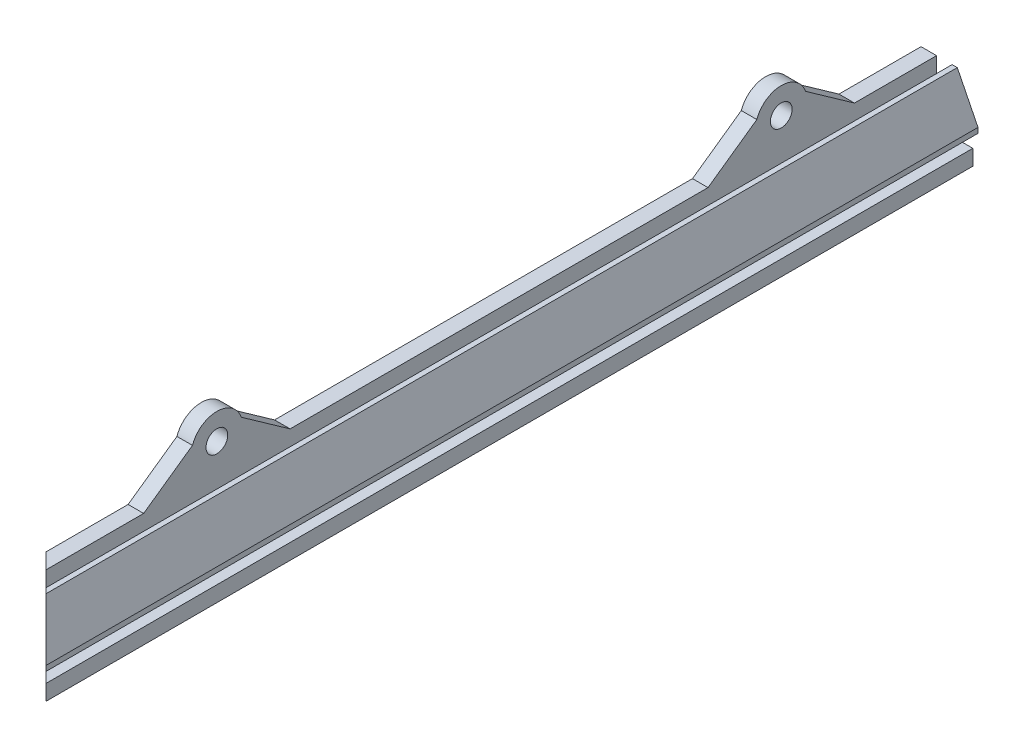
from build123d import *

# Parameters (mm, degrees)
DODANIE_WYCI_GNI_CIE1_DEPTH = 180
WYTNIJ_WYCI_GNI_CIE1_DEPTH  = 181.958558792
SZKIC3_R                    = 2.1
DODANIE_WYCI_GNI_CIE2_DEPTH = 3
SFAZOWANIE1_DEPTH           = 3


with BuildPart() as part:
    # Szkic1 → Dodanie-wyciągnięcie1 (new body)
    with BuildSketch(Plane.XY):
        Polygon((0, 0), (10, 0), (10, 3), (3, 3), (3, 6), (11, 6), (11, 7), (7, 15), (6, 15), (6, 9), (3, 9), (3, 15), (0, 15), align=None)
    extrude(amount=DODANIE_WYCI_GNI_CIE1_DEPTH)

    # Szkic2 → Wytnij-wyciągnięcie1 (cut, through all)
    with BuildSketch(Plane(origin=(0, 15, 0), x_dir=(1, 0, 0), z_dir=(0, 1, 0))):
        Polygon((0, -180), (11, -180), (0, -169), align=None)
    extrude(amount=-WYTNIJ_WYCI_GNI_CIE1_DEPTH, mode=Mode.SUBTRACT)

    # Szkic3 → Dodanie-wyciągnięcie2 (add)
    # profile 1 of 2: a face of its own
    with BuildSketch(Plane.ZY):
        with BuildLine():
            Line((25, 20), (25, 11.336506418))
            Line((25, 11.336506418), (35, 11.336506418))
            Line((35, 11.336506418), (35, 20))
            ThreePointArc((35, 20), (30, 25), (25, 20))
        make_face()
        with Locations((30, 20)):
            Circle(SZKIC3_R, mode=Mode.SUBTRACT)
    # profile 2 of 2: a face of its own
    with BuildSketch(Plane.ZY):
        with BuildLine():
            Line((134, 20), (134, 11.336506418))
            Line((134, 11.336506418), (144, 11.336506418))
            Line((144, 11.336506418), (144, 20))
            ThreePointArc((144, 20), (139, 25), (134, 20))
        make_face()
        with Locations((139, 20)):
            Circle(SZKIC3_R, mode=Mode.SUBTRACT)
    extrude(amount=-DODANIE_WYCI_GNI_CIE2_DEPTH)

    # Sfazowanie1: read off the stored shape, not the designer's step
    # Sfazowanie1 outline → Sfazowanie1 (add)
    with BuildSketch(Plane.YZ):
        with BuildLine():
            Line((15, 134), (15, 124.857864376))
            Line((15, 124.857864376), (21.666666667, 134.285954792))
            ThreePointArc((21.666666667, 134.285954792), (20.845509894, 134.072007202), (20, 134))
            Line((20, 134), (15, 134))
        make_face()
        with BuildLine():
            Line((15, 15.857864376), (21.666666667, 25.285954792))
            ThreePointArc((21.666666667, 25.285954792), (20.845509894, 25.072007202), (20, 25))
            Line((20, 25), (15, 25))
            Line((15, 25), (15, 15.857864376))
        make_face()
        with BuildLine():
            Line((21.666666667, 34.714045208), (15, 44.142135624))
            Line((15, 44.142135624), (15, 35))
            Line((15, 35), (20, 35))
            ThreePointArc((20, 35), (20.845509894, 34.927992798), (21.666666667, 34.714045208))
        make_face()
        with BuildLine():
            ThreePointArc((20, 144), (20.845509894, 143.927992798), (21.666666667, 143.714045208))
            Line((21.666666667, 143.714045208), (15, 153.142135624))
            Line((15, 153.142135624), (15, 144))
            Line((15, 144), (20, 144))
        make_face()
    extrude(amount=SFAZOWANIE1_DEPTH)


solid = part.part
